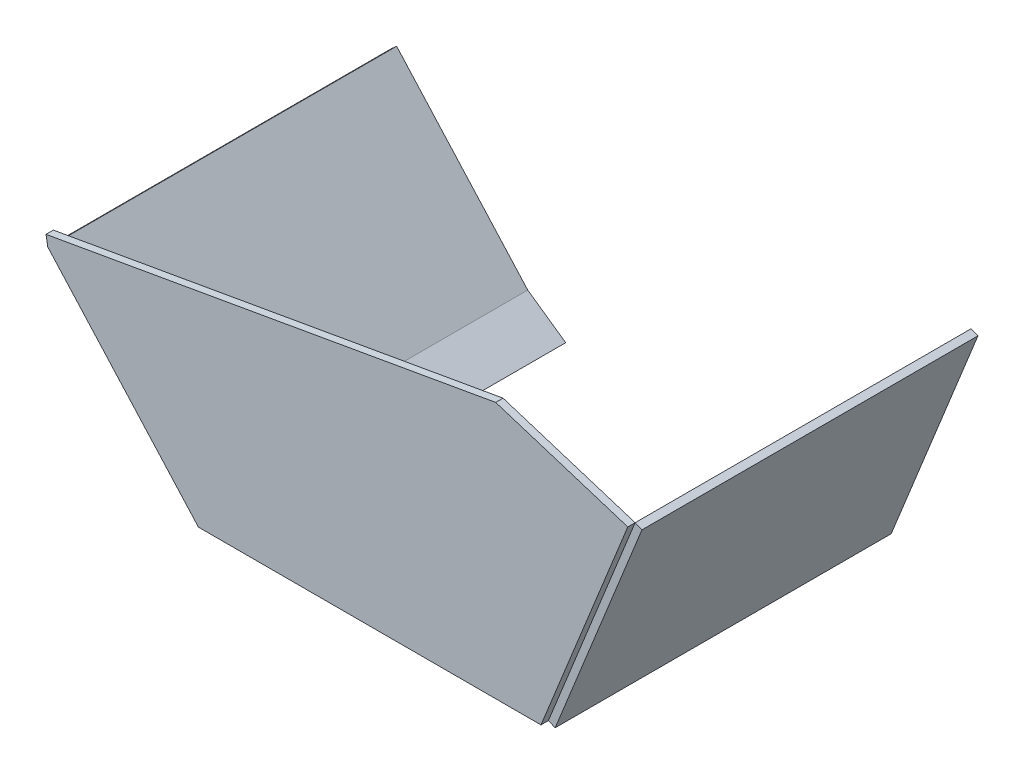
from build123d import *

# Parameters (mm, degrees)
BOSS_EXTRUDE1_DEPTH   = 290
BOSS_EXTRUDE1_2_DEPTH = 290
BOSS_EXTRUDE2_DEPTH   = 6.35


with BuildPart() as part:
    # Sketch1 → Boss-Extrude1 (new body)
    with BuildSketch(Plane.XY):
        Polygon((-164.212051746, 22.943057454), (-277.380151297, 148.628965095), (-282.099120939, 144.379985745), (-152.098797859, 0), (-131.445969974, 0), align=None)
    extrude(amount=BOSS_EXTRUDE1_DEPTH)

    # Sketch2 → Boss-Extrude2 (add)
    with BuildSketch(Plane.XY.offset(290)):
        Polygon((-152.098797859, 0), (-282.099120939, 144.379985745), (-283.631995432, 153.07334899), (104.495710829, 221.510735565), (218.475348709, 185.436770913), (143.554030026, 0), align=None)
    extrude(amount=BOSS_EXTRUDE2_DEPTH)


with BuildPart() as body_2:
    # Sketch1 → Boss-Extrude1 2 (new body)
    with BuildSketch(Plane.XY):
        Polygon((143.554030026, 0), (149.441647502, -2.378751868), (224.362966185, 183.058019045), (218.475348709, 185.436770913), align=None)
    extrude(amount=BOSS_EXTRUDE1_2_DEPTH)


solid = Compound([part.part, body_2.part])
